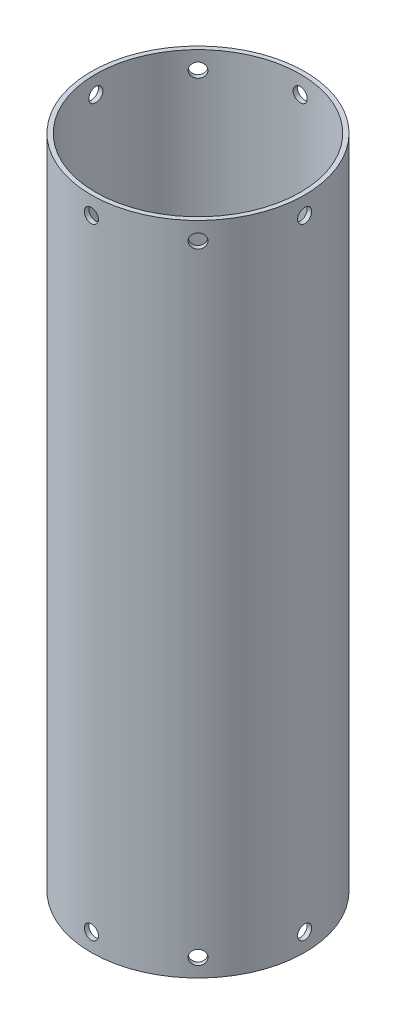
from build123d import *

# Parameters (mm, degrees)
SKETCH1_R               = 76.2
SKETCH1_R_2             = 73.025
BOSS_EXTRUDE1_DEPTH     = 467.995
CUT_EXTRUDE1_REACH      = 457.525
CUT_EXTRUDE1_END_RADIUS = 76.2
SKETCH4_R               = 5.0165
CIRPATTERN3_COUNT       = 8
CUT_EXTRUDE2_REACH      = 457.525
CUT_EXTRUDE2_END_RADIUS = 76.2
SKETCH7_R               = 5.0165
CIRPATTERN4_COUNT       = 8


with BuildPart() as part:
    # Sketch1 → Boss-Extrude1 (new body)
    with BuildSketch(Plane(origin=(0, 0, 0), x_dir=(1, 0, 0), z_dir=(0, 1, 0))):
        Circle(SKETCH1_R)
        Circle(SKETCH1_R_2, mode=Mode.SUBTRACT)
    extrude(amount=BOSS_EXTRUDE1_DEPTH)

    # Cut-Extrude1: up to this cylinder (the profile starts inside it)
    cut_extrude1_end = Plane(origin=(0, 455.295, 0), z_dir=(0, -1, 0)) * Cylinder(CUT_EXTRUDE1_END_RADIUS, 1068.45, mode=Mode.PRIVATE)
    # Sketch4 → Cut-Extrude1 (cut, up to the surface)
    with BuildSketch(Plane(origin=(0, 442.595, 0), x_dir=(0, 0, 1), z_dir=(1, 0, 0)), mode=Mode.PRIVATE) as cut_extrude1_sk1:
        with Locations((0, -12.7)):
            Circle(SKETCH4_R)
    cut_extrude1_tool1 = extrude(cut_extrude1_sk1.sketch, amount=CUT_EXTRUDE1_REACH, mode=Mode.PRIVATE) & cut_extrude1_end
    cut_extrude1 = cut_extrude1_tool1.solids().sort_by_distance((0, 455.295, 0))[0]
    add(cut_extrude1, mode=Mode.SUBTRACT)

    # CirPattern3: Cut-Extrude1 ×8 about axis
    cirpattern3_axis = Axis((0, 467.995, 0), (0, 1, 0))
    for i in range(1, CIRPATTERN3_COUNT):
        add(cut_extrude1.rotate(cirpattern3_axis, i * 360 / CIRPATTERN3_COUNT), mode=Mode.SUBTRACT)

    # Cut-Extrude2: up to this cylinder (the profile starts inside it)
    cut_extrude2_end = Plane(origin=(0, 12.7, 0), z_dir=(0, -1, 0)) * Cylinder(CUT_EXTRUDE2_END_RADIUS, 1068.45, mode=Mode.PRIVATE)
    # Sketch7 → Cut-Extrude2 (cut, up to the surface)
    with BuildSketch(Plane(origin=(0, 25.4, 0), x_dir=(0, 0, -1), z_dir=(1, 0, 0)), mode=Mode.PRIVATE) as cut_extrude2_sk1:
        with Locations((0, -12.7)):
            Circle(SKETCH7_R)
    cut_extrude2_tool1 = extrude(cut_extrude2_sk1.sketch, amount=CUT_EXTRUDE2_REACH, mode=Mode.PRIVATE) & cut_extrude2_end
    cut_extrude2 = cut_extrude2_tool1.solids().sort_by_distance((0, 12.7, 0))[0]
    add(cut_extrude2, mode=Mode.SUBTRACT)

    # CirPattern4: Cut-Extrude2 ×8 about axis
    cirpattern4_axis = Axis((0, 0, 0), (0, 1, 0))
    for i in range(1, CIRPATTERN4_COUNT):
        add(cut_extrude2.rotate(cirpattern4_axis, i * 360 / CIRPATTERN4_COUNT), mode=Mode.SUBTRACT)


solid = part.part
